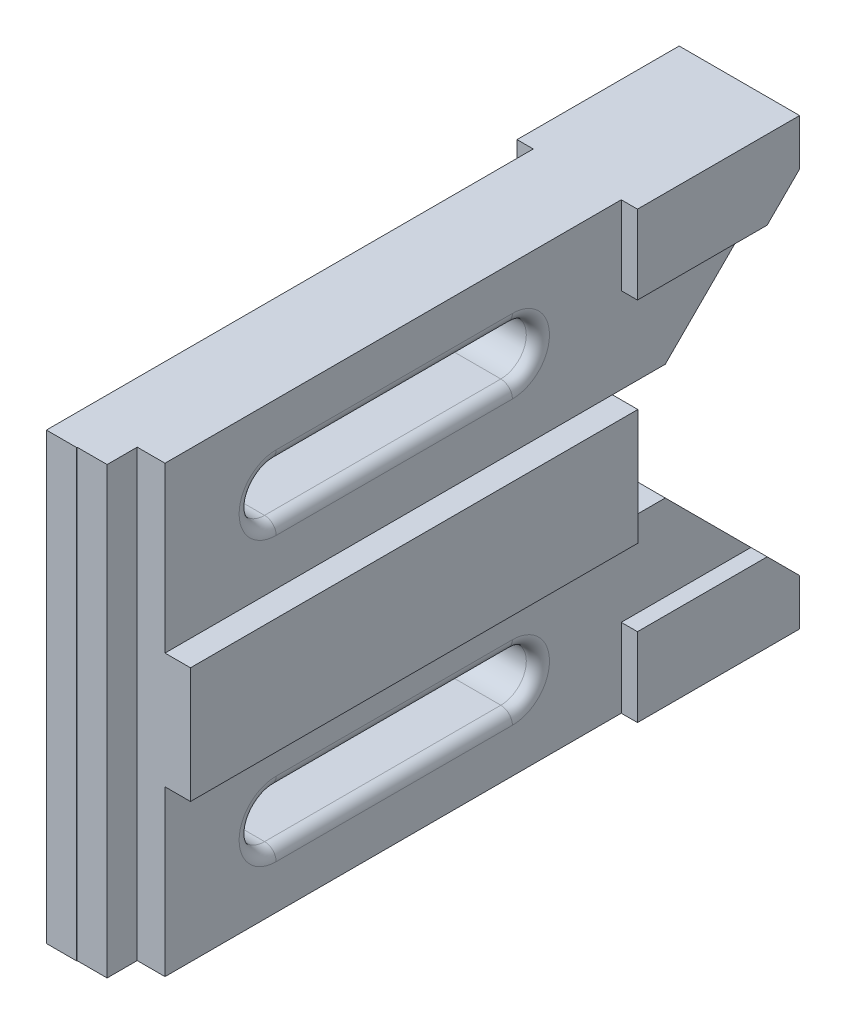
from build123d import *

# Parameters (mm, degrees)
BOSS_EXTRUDE8_DEPTH   = 13
BOSS_EXTRUDE8_2_DEPTH = 13
SKETCH1_14_W          = 96.584344236
SKETCH1_14_H          = 25
BOSS_EXTRUDE9_DEPTH   = 15
BOSS_EXTRUDE10_DEPTH  = 9.5
EXTRUDE_THIN3_START   = -96
EXTRUDE_THIN3_DEPTH   = 96
FILLET1_R             = 2.5


# Read off the part's stored shape, not the designer's step: Extrude-Thin3
with BuildPart() as part:
    # Sketch1 → Boss-Extrude8 (new, symmetric)
    with BuildSketch(Plane(origin=(0, 0, 0), x_dir=(0, 0, -1), z_dir=(1, 0, 0))):
        Polygon((140, 48), (105, 48), (105, 31), (133, 31), (140, 38), align=None)
    extrude(amount=BOSS_EXTRUDE8_DEPTH, both=True)



with BuildPart() as body_2:
    # Sketch1 → Boss-Extrude8 2 (new, symmetric)
    with BuildSketch(Plane(origin=(0, 0, 0), x_dir=(0, 0, -1), z_dir=(1, 0, 0))):
        Polygon((105, -31), (105, -48), (140, -48), (140, -38), (133, -31), align=None)
    extrude(amount=BOSS_EXTRUDE8_2_DEPTH, both=True)


with BuildPart() as body_3:
    # Sketch1<14> → Boss-Extrude9 (new, symmetric)
    with BuildSketch(Plane(origin=(0, 0, 0), x_dir=(0, 0, -1), z_dir=(1, 0, 0))):
        with Locations((54.792172118, 0)):
            Rectangle(SKETCH1_14_W, SKETCH1_14_H)
    extrude(amount=BOSS_EXTRUDE9_DEPTH, both=True)


with BuildPart() as part_1:
    add(part.part)

    add(body_2.part)  # Boss-Extrude10 merges body 2

    add(body_3.part)  # Boss-Extrude10 merges body 3
    # Sketch1<15> → Boss-Extrude10 (add, symmetric)
    # profile 1 of 2: a face of its own
    with BuildSketch(Plane(origin=(0, 0, 0), x_dir=(0, 0, -1), z_dir=(1, 0, 0))):
        Polygon((6.5, 48), (6.5, 12.5), (103.084344236, 12.5), (114.5, 12.5), (133, 31), (105, 31), (105, 48), align=None)
        with BuildLine():
            ThreePointArc((30.5, 25), (25, 30.5), (30.5, 36))
            Line((30.5, 36), (81.5, 36))
            ThreePointArc((81.5, 36), (87, 30.5), (81.5, 25))
            Line((81.5, 25), (30.5, 25))
        make_face(mode=Mode.SUBTRACT)
    # profile 2 of 2: a face of its own
    with BuildSketch(Plane(origin=(0, 0, 0), x_dir=(0, 0, -1), z_dir=(1, 0, 0))):
        Polygon((6.5, -12.5), (6.5, -48), (105, -48), (105, -31), (133, -31), (114.5, -12.5), (103.084344236, -12.5), align=None)
        with BuildLine():
            Line((81.5, -36), (30.5, -36))
            ThreePointArc((30.5, -36), (25, -30.5), (30.5, -25))
            Line((30.5, -25), (81.5, -25))
            ThreePointArc((81.5, -25), (87, -30.5), (81.5, -36))
        make_face(mode=Mode.SUBTRACT)
    extrude(amount=BOSS_EXTRUDE10_DEPTH, both=True)

    # Extrude-Thin3 outline → Extrude-Thin3 (add)
    with BuildSketch(Plane(origin=(0, 48, 0), x_dir=(1, 0, 0), z_dir=(0, 1, 0)).offset(EXTRUDE_THIN3_START)):
        Polygon((-9.5, -0.104199667), (-3, -0.104199667), (-3, 0), (3.5, 0), (3.5, 6.5), (-9.5, 6.5), align=None)
    extrude(amount=EXTRUDE_THIN3_DEPTH)

    # Fillet1
    fillet1_edges = [part_1.edges().sort_by_distance(p)[0] for p in [
        (9.5, 30.5, -87),
        (9.5, 25, -56),
        (9.5, 30.5, -25),
        (-9.5, 36, -56),
        (9.5, 36, -56),
        (-9.5, 30.5, -87),
        (-9.5, 30.5, -25),
        (-9.5, 25, -56),
        (-9.5, -25, -56),
        (-9.5, -30.5, -87),
        (9.5, -36, -56),
        (-9.5, -30.5, -25),
        (9.5, -25, -56),
        (9.5, -30.5, -87),
        (9.5, -30.5, -25),
        (-9.5, -36, -56),
    ]]
    fillet(fillet1_edges, radius=FILLET1_R)


solid = part_1.part
